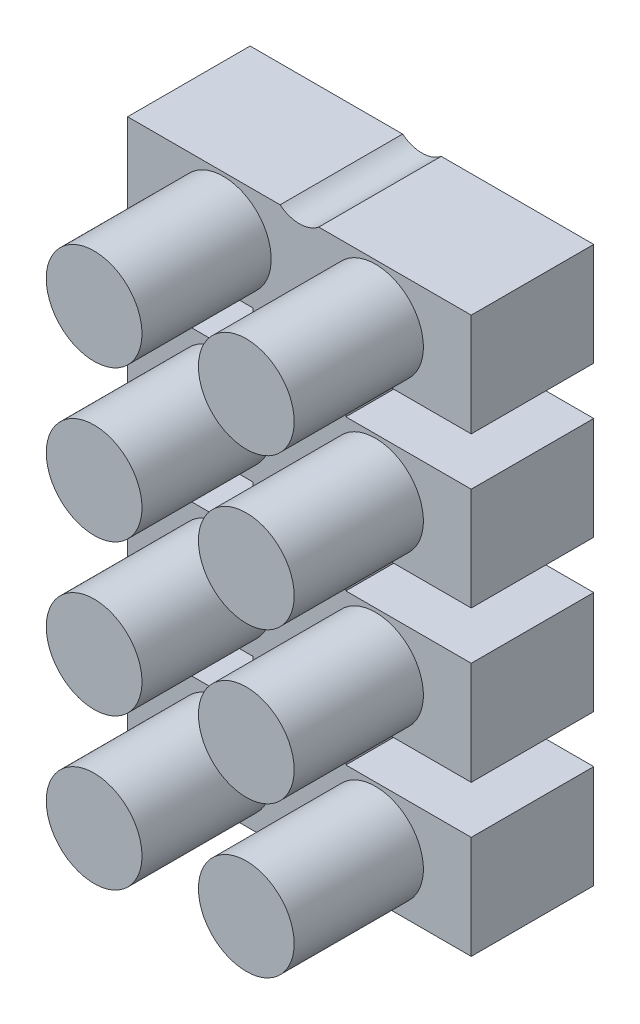
from build123d import *

# Parameters (mm, degrees)
SKETCH1_W                 = 18.2372
SKETCH1_H                 = 13.4874
BOSS_EXTRUDE1_DEPTH       = 6.5024
SKETCH2_W                 = 6.6548
SKETCH2_H                 = 2.54
CUT_EXTRUDE1_DEPTH        = 14.073161875
SKETCH5_R                 = 2.54
BOSS_EXTRUDE2_DEPTH       = 6.858
SKETCH6_W                 = 18.2372
SKETCH6_H                 = 5.4737
CUT_EXTRUDE2_DEPTH        = 14.253622888
F_4_CLEARANCE_HOLE1_D     = 3.2639
LPATTERN1_COUNT           = 4
LPATTERN1_PITCH           = 8.001
LPATTERN1_COPY_1_SKETCH_W = 6.6548
LPATTERN1_COPY_1_SKETCH_H = 2.54
LPATTERN1_COPY_1_DEPTH    = 14.073161875
LPATTERN1_COPY_2_SKETCH_W = 6.6548
LPATTERN1_COPY_2_SKETCH_H = 2.54
LPATTERN1_COPY_2_DEPTH    = 14.073161875
LPATTERN1_COPY_3_SKETCH_W = 6.6548
LPATTERN1_COPY_3_SKETCH_H = 2.54
LPATTERN1_COPY_3_DEPTH    = 14.073161875
LPATTERN1_COPY_4_SKETCH_R = 2.54
LPATTERN1_COPY_4_DEPTH    = 6.858
LPATTERN1_COPY_5_SKETCH_R = 2.54
LPATTERN1_COPY_5_DEPTH    = 6.858
LPATTERN1_COPY_6_SKETCH_R = 2.54
LPATTERN1_COPY_6_DEPTH    = 6.858
SKETCH7_W                 = 18.2372
SKETCH7_H                 = 8.0137
CUT_EXTRUDE3_DEPTH        = 33.795435519


with BuildPart() as part:
    # Sketch1 → Boss-Extrude1 (new body)
    with BuildSketch(Plane.XY):
        Rectangle(SKETCH1_W, SKETCH1_H)
    boss_extrude1 = extrude(amount=BOSS_EXTRUDE1_DEPTH)

    # Sketch2 → Cut-Extrude1 (cut, through all)
    with BuildSketch(Plane.XY.offset(6.5024)):
        with Locations((5.7912, 0)):
            Rectangle(SKETCH2_W, SKETCH2_H)
    cut_extrude1 = extrude(amount=-CUT_EXTRUDE1_DEPTH, mode=Mode.SUBTRACT)

    # Sketch5 → Boss-Extrude2 (add)
    with BuildSketch(Plane.XY.offset(6.5024)):
        with Locations((4.0386, -4.00685)):
            Circle(SKETCH5_R)
    boss_extrude2 = extrude(amount=BOSS_EXTRUDE2_DEPTH)

    # Sketch6 → Cut-Extrude2 (cut, through all)
    with BuildSketch(Plane.XY.offset(6.5024)):
        with Locations((0, 4.00685)):
            Rectangle(SKETCH6_W, SKETCH6_H)
    extrude(amount=-CUT_EXTRUDE2_DEPTH, mode=Mode.SUBTRACT)

    # #4 Clearance Hole1 (through all)
    with Locations(Plane.XY.offset(6.5024)):
        with Locations((0, 0)):
            f_4_clearance_hole1 = Hole(F_4_CLEARANCE_HOLE1_D / 2)

    # Mirror4: Cut-Extrude1, Boss-Extrude2 across plane
    add(cut_extrude1.mirror(Plane(origin=(0, 0, 0), x_dir=(0, 0, 1), z_dir=(1, 0, 0))), mode=Mode.SUBTRACT)
    add(boss_extrude2.mirror(Plane(origin=(0, 0, 0), x_dir=(0, 0, 1), z_dir=(1, 0, 0))))

    # LPattern1: Boss-Extrude1, Cut-Extrude1, Boss-Extrude2, #4 Clearance Hole1 ×4
    with Locations(*[(0, i * LPATTERN1_PITCH, 0) for i in range(1, LPATTERN1_COUNT)]):
        add(boss_extrude1)
        add(cut_extrude1, mode=Mode.SUBTRACT)
        add(boss_extrude2)
        add(f_4_clearance_hole1, mode=Mode.SUBTRACT)

    # LPattern1 copy 1 sketch → LPattern1 copy 1 (cut, through all)
    with BuildSketch(Plane(origin=(0, 8.001, 6.5024), x_dir=(-1, 0, 0), z_dir=(0, 0, 1))):
        with Locations((5.7912, 0)):
            Rectangle(LPATTERN1_COPY_1_SKETCH_W, LPATTERN1_COPY_1_SKETCH_H)
    extrude(amount=-LPATTERN1_COPY_1_DEPTH, mode=Mode.SUBTRACT)

    # LPattern1 copy 2 sketch → LPattern1 copy 2 (cut, through all)
    with BuildSketch(Plane(origin=(0, 16.002, 6.5024), x_dir=(-1, 0, 0), z_dir=(0, 0, 1))):
        with Locations((5.7912, 0)):
            Rectangle(LPATTERN1_COPY_2_SKETCH_W, LPATTERN1_COPY_2_SKETCH_H)
    extrude(amount=-LPATTERN1_COPY_2_DEPTH, mode=Mode.SUBTRACT)

    # LPattern1 copy 3 sketch → LPattern1 copy 3 (cut, through all)
    with BuildSketch(Plane(origin=(0, 24.003, 6.5024), x_dir=(-1, 0, 0), z_dir=(0, 0, 1))):
        with Locations((5.7912, 0)):
            Rectangle(LPATTERN1_COPY_3_SKETCH_W, LPATTERN1_COPY_3_SKETCH_H)
    extrude(amount=-LPATTERN1_COPY_3_DEPTH, mode=Mode.SUBTRACT)

    # LPattern1 copy 4 sketch → LPattern1 copy 4 (add)
    with BuildSketch(Plane(origin=(0, 8.001, 6.5024), x_dir=(-1, 0, 0), z_dir=(0, 0, 1))):
        with Locations((4.0386, 4.00685)):
            Circle(LPATTERN1_COPY_4_SKETCH_R)
    extrude(amount=LPATTERN1_COPY_4_DEPTH)

    # LPattern1 copy 5 sketch → LPattern1 copy 5 (add)
    with BuildSketch(Plane(origin=(0, 16.002, 6.5024), x_dir=(-1, 0, 0), z_dir=(0, 0, 1))):
        with Locations((4.0386, 4.00685)):
            Circle(LPATTERN1_COPY_5_SKETCH_R)
    extrude(amount=LPATTERN1_COPY_5_DEPTH)

    # LPattern1 copy 6 sketch → LPattern1 copy 6 (add)
    with BuildSketch(Plane(origin=(0, 24.003, 6.5024), x_dir=(-1, 0, 0), z_dir=(0, 0, 1))):
        with Locations((4.0386, 4.00685)):
            Circle(LPATTERN1_COPY_6_SKETCH_R)
    extrude(amount=LPATTERN1_COPY_6_DEPTH)

    # Sketch7 → Cut-Extrude3 (cut, through all)
    with BuildSketch(Plane.XY.offset(6.5024)):
        with Locations((0, 26.73985)):
            Rectangle(SKETCH7_W, SKETCH7_H)
    extrude(amount=-CUT_EXTRUDE3_DEPTH, mode=Mode.SUBTRACT)


solid = part.part
